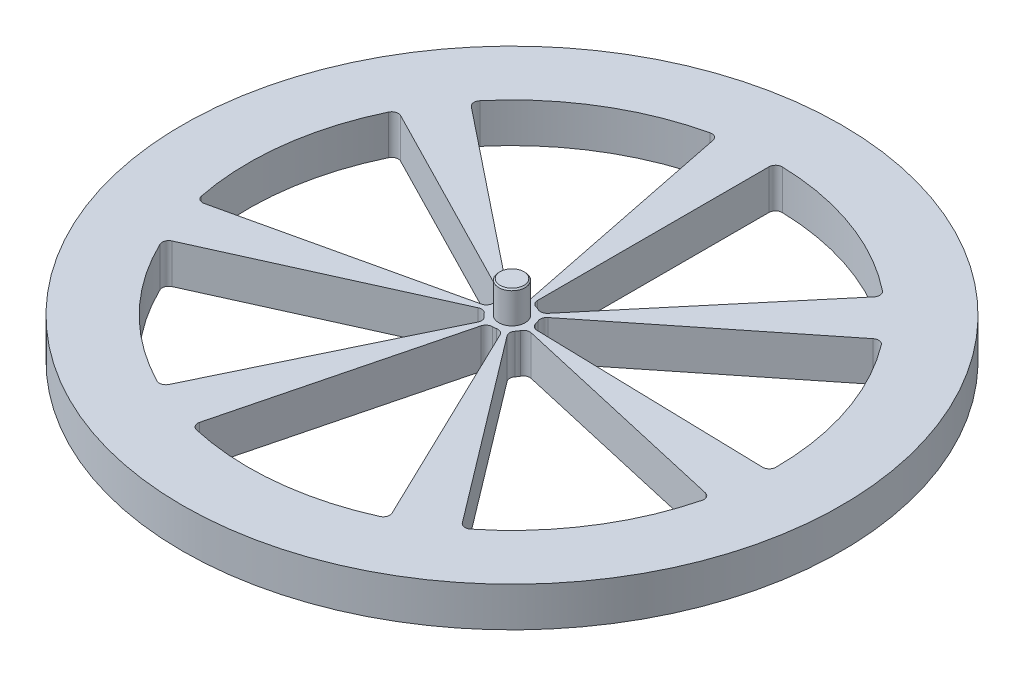
from build123d import *

# Parameters (mm, degrees)
SKETCH1_R                = 250
BOSS_EXTRUDE1_DEPTH      = 30
CUT_EXTRUDE1_DEPTH       = 355.823899984
FILLET1_R                = 5
CIRPATTERN1_COUNT        = 7
FILLET1_OF_CIRPATTERN1_R = 5
SKETCH3_R                = 10
BOSS_EXTRUDE2_DEPTH      = 24.1
CHAMFER1_SIZE            = 1


with BuildPart() as part:
    # Sketch1 → Boss-Extrude1 (new body)
    with BuildSketch(Plane(origin=(0, 0, 0), x_dir=(1, 0, 0), z_dir=(0, 1, 0))):
        Circle(SKETCH1_R)
    extrude(amount=BOSS_EXTRUDE1_DEPTH)

    # Sketch2 → Cut-Extrude1 (cut, through all)
    with BuildSketch(Plane(origin=(0, 30, 0), x_dir=(1, 0, 0), z_dir=(0, 1, 0))):
        with BuildLine():
            Line((0, 15), (0, 200))
            ThreePointArc((0, 200), (68.404028665, 187.938524157), (128.557521937, 153.208888624))
            Line((128.557521937, 153.208888624), (9.641814145, 11.490666647))
            ThreePointArc((9.641814145, 11.490666647), (5.13030215, 14.095389312), (0, 15))
        make_face()
    cut_extrude1 = extrude(amount=-CUT_EXTRUDE1_DEPTH, mode=Mode.SUBTRACT)

    # Fillet1
    fillet1_edges = [part.edges().sort_by_distance(p)[0] for p in [
        (128.557521937, 15, -153.208888624),
        (0, 15, -200),
        (9.641814145, 15, -11.490666647),
        (0, 15, -15),
    ]]
    fillet(fillet1_edges, radius=FILLET1_R)

    # CirPattern1: Cut-Extrude1 ×7 about axis
    cirpattern1_axis = Axis((0, 30, 0), (0, -1, 0))
    for i in range(1, CIRPATTERN1_COUNT):
        add(cut_extrude1.rotate(cirpattern1_axis, i * 360 / CIRPATTERN1_COUNT), mode=Mode.SUBTRACT)

    # Fillet1 of CirPattern1
    fillet1_of_cirpattern1_edges = [part.edges().sort_by_distance(p)[0] for p in [
        (199.9378364, 15, 4.986138348),
        (156.366296494, 15, -124.697960372),
        (14.99533773, 15, 0.373960376),
        (11.727472237, 15, -9.352347028),
        (120.760882065, 15, 159.426501445),
        (194.985582436, 15, 44.504186791),
        (9.057066155, 15, 11.956987608),
        (14.623918683, 15, 3.337814009),
        (-49.351479538, 15, 193.815457246),
        (86.776747824, 15, 180.19377358),
        (-3.701360965, 15, 14.536159293),
        (6.508256087, 15, 13.514533019),
        (-182.301170462, 15, 82.257420626),
        (-86.776747824, 15, 180.19377358),
        (-13.672587785, 15, 6.169306547),
        (-6.508256087, 15, 13.514533019),
        (-177.974361762, 15, -91.242131471),
        (-194.985582436, 15, 44.504186791),
        (-13.348077132, 15, -6.84315986),
        (-14.623918683, 15, 3.337814009),
        (-39.62922864, 15, -196.03449757),
        (-156.366296494, 15, -124.697960372),
        (-2.972192148, 15, -14.702587318),
        (-11.727472237, 15, -9.352347028),
    ]]
    fillet(fillet1_of_cirpattern1_edges, radius=FILLET1_OF_CIRPATTERN1_R)

    # Sketch3 → Boss-Extrude2 (add)
    with BuildSketch(Plane(origin=(0, 30, 0), x_dir=(1, 0, 0), z_dir=(0, 1, 0))):
        Circle(SKETCH3_R)
    extrude(amount=BOSS_EXTRUDE2_DEPTH)

    # Chamfer1
    chamfer1_edges = [part.edges().sort_by_distance(p)[0] for p in [
        (-10, 54.1, 0),
    ]]
    chamfer(chamfer1_edges, length=CHAMFER1_SIZE)


solid = part.part
